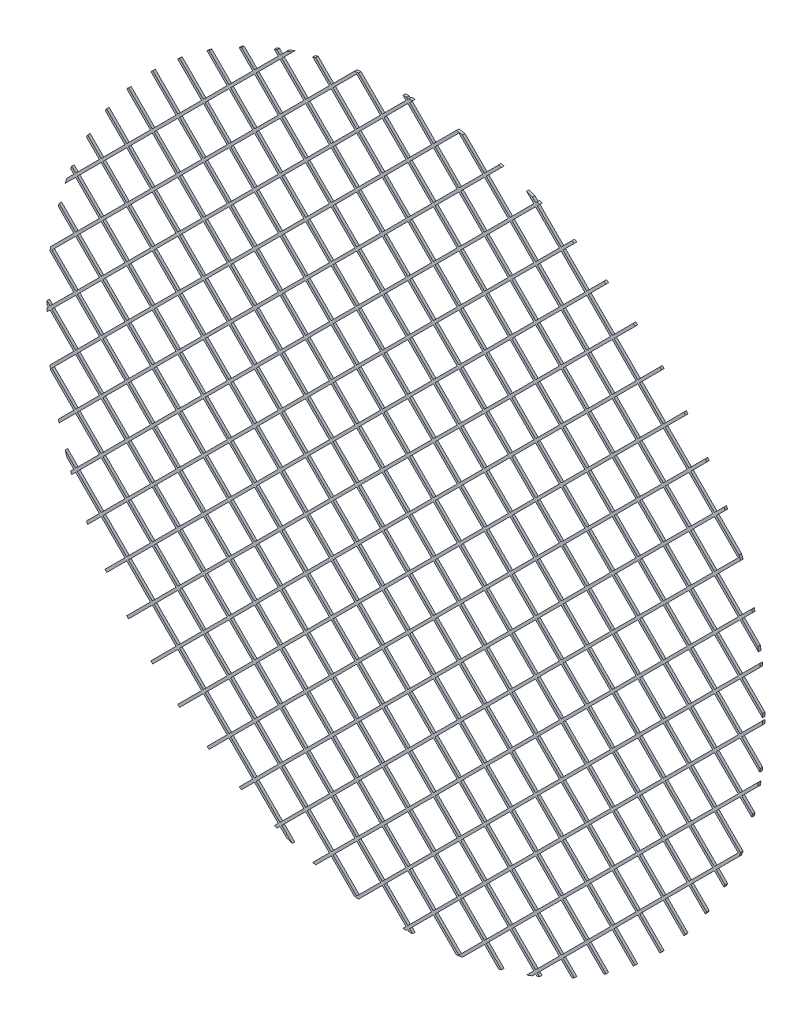
from build123d import *

# Parameters (mm, degrees)
BOSS_EXTRUDE1_DEPTH = 0.05


with BuildPart() as part:
    # Sketch1 → Boss-Extrude1 (new body)
    with BuildSketch(Plane.XY):
        with BuildLine():
            Line((6.560216282, 0.405728477), (6.99991756, -0.033972801))
            ThreePointArc((6.99991756, -0.033972801), (6.999999862, 0.001389576), (6.999903521, 0.036751917))
            Line((6.999903521, 0.036751917), (6.595571621, 0.441083816))
            Line((6.595571621, 0.441083816), (6.954171805, 0.799684))
            ThreePointArc((6.954171805, 0.799684), (6.950466767, 0.831271144), (6.946618255, 0.862841128))
            Line((6.946618255, 0.862841128), (6.560216282, 0.476439155))
            Line((6.560216282, 0.476439155), (6.095571621, 0.941083816))
            Line((6.095571621, 0.941083816), (6.560216282, 1.405728477))
            Line((6.560216282, 1.405728477), (6.921667842, 1.044276917))
            ThreePointArc((6.921667842, 1.044276917), (6.915206502, 1.086240784), (6.90849075, 1.128164688))
            Line((6.90849075, 1.128164688), (6.595571621, 1.441083816))
            Line((6.595571621, 1.441083816), (6.80309457, 1.648606765))
            ThreePointArc((6.80309457, 1.648606765), (6.796156305, 1.676979273), (6.789099711, 1.705322584))
            Line((6.789099711, 1.705322584), (6.560216282, 1.476439155))
            Line((6.560216282, 1.476439155), (6.095571621, 1.941083816))
            Line((6.095571621, 1.941083816), (6.570022305, 2.415534499))
            ThreePointArc((6.570022305, 2.415534499), (6.554836229, 2.456444994), (6.539395413, 2.497260024))
            Line((6.539395413, 2.497260024), (6.095571621, 2.941083816))
            Line((6.095571621, 2.941083816), (6.268970842, 3.114483036))
            ThreePointArc((6.268970842, 3.114483036), (6.257206329, 3.138051777), (6.245353208, 3.16157608))
            Line((6.245353208, 3.16157608), (6.060216282, 2.976439155))
            Line((6.060216282, 2.976439155), (5.595571621, 3.441083816))
            Line((5.595571621, 3.441083816), (5.908345803, 3.753857998))
            ThreePointArc((5.908345803, 3.753857998), (5.894581525, 3.775434895), (5.88073845, 3.796961323))
            Line((5.88073845, 3.796961323), (5.560216282, 3.476439155))
            Line((5.560216282, 3.476439155), (5.095571621, 3.941083816))
            Line((5.095571621, 3.941083816), (5.493216795, 4.33872899))
            ThreePointArc((5.493216795, 4.33872899), (5.477585869, 4.358446173), (5.461884172, 4.378107045))
            Line((5.461884172, 4.378107045), (5.060216282, 3.976439155))
            Line((5.060216282, 3.976439155), (4.595571621, 4.441083816))
            Line((4.595571621, 4.441083816), (5.026388615, 4.871900809))
            ThreePointArc((5.026388615, 4.871900809), (5.008955648, 4.889822422), (4.991458782, 4.907681655))
            Line((4.991458782, 4.907681655), (4.560216282, 4.476439155))
            Line((4.560216282, 4.476439155), (4.095571621, 4.941083816))
            Line((4.095571621, 4.941083816), (4.508904605, 5.3544168))
            ThreePointArc((4.508904605, 5.3544168), (4.489676545, 5.370549741), (4.470390761, 5.386613634))
            Line((4.470390761, 5.386613634), (4.060216282, 4.976439155))
            Line((4.060216282, 4.976439155), (3.595571621, 5.441083816))
            Line((3.595571621, 5.441083816), (3.940218423, 5.785730618))
            ThreePointArc((3.940218423, 5.785730618), (3.919145654, 5.800025633), (3.898021024, 5.814243897))
            Line((3.898021024, 5.814243897), (3.560216282, 5.476439155))
            Line((3.560216282, 5.476439155), (3.095571621, 5.941083816))
            Line((3.095571621, 5.941083816), (3.318105121, 6.163617315))
            ThreePointArc((3.318105121, 6.163617315), (3.295073238, 6.175960845), (3.271995438, 6.18821831))
            Line((3.271995438, 6.18821831), (3.060216282, 5.976439155))
            Line((3.060216282, 5.976439155), (2.595571621, 6.441083816))
            Line((2.595571621, 6.441083816), (2.638275473, 6.483787668))
            ThreePointArc((2.638275473, 6.483787668), (2.61308431, 6.493981089), (2.587853764, 6.504076637))
            Line((2.587853764, 6.504076637), (2.560216282, 6.476439155))
            Line((2.560216282, 6.476439155), (2.497260024, 6.539395413))
            ThreePointArc((2.497260024, 6.539395413), (2.441044694, 6.560586925), (2.384649563, 6.581295197))
            Line((2.384649563, 6.581295197), (2.524860943, 6.441083816))
            Line((2.524860943, 6.441083816), (2.060216282, 5.976439155))
            Line((2.060216282, 5.976439155), (1.595571621, 6.441083816))
            Line((1.595571621, 6.441083816), (1.893521569, 6.739033764))
            ThreePointArc((1.893521569, 6.739033764), (1.865841371, 6.746750031), (1.838129731, 6.754352604))
            Line((1.838129731, 6.754352604), (1.560216282, 6.476439155))
            Line((1.560216282, 6.476439155), (1.128164688, 6.90849075))
            ThreePointArc((1.128164688, 6.90849075), (1.069352141, 6.917838246), (1.010462203, 6.926685076))
            Line((1.010462203, 6.926685076), (0.560216282, 6.476439155))
            Line((0.560216282, 6.476439155), (0.095571621, 6.941083816))
            Line((0.095571621, 6.941083816), (0.152819478, 6.998331673))
            ThreePointArc((0.152819478, 6.998331673), (0.118052042, 6.99900448), (0.083281692, 6.999504565))
            Line((0.083281692, 6.999504565), (0.060216282, 6.976439155))
            Line((0.060216282, 6.976439155), (0.036751917, 6.999903521))
            ThreePointArc((0.036751917, 6.999903521), (0.001389576, 6.999999862), (-0.033972801, 6.99991756))
            Line((-0.033972801, 6.99991756), (0.024860943, 6.941083816))
            Line((0.024860943, 6.941083816), (-0.439783718, 6.476439155))
            Line((-0.439783718, 6.476439155), (-0.904642812, 6.941298249))
            ThreePointArc((-0.904642812, 6.941298249), (-0.945345455, 6.935872113), (-0.986015567, 6.930207306))
            Line((-0.986015567, 6.930207306), (-1.439783718, 6.476439155))
            Line((-1.439783718, 6.476439155), (-1.742895756, 6.779551193))
            ThreePointArc((-1.742895756, 6.779551193), (-1.770937395, 6.772280321), (-1.798948704, 6.764893463))
            Line((-1.798948704, 6.764893463), (-1.475139057, 6.441083816))
            Line((-1.475139057, 6.441083816), (-1.939783718, 5.976439155))
            Line((-1.939783718, 5.976439155), (-2.404428379, 6.441083816))
            Line((-2.404428379, 6.441083816), (-2.200318583, 6.645193611))
            ThreePointArc((-2.200318583, 6.645193611), (-2.253969831, 6.627187941), (-2.307473759, 6.608749114))
            Line((-2.307473759, 6.608749114), (-2.439783718, 6.476439155))
            Line((-2.439783718, 6.476439155), (-2.501224607, 6.537880044))
            ThreePointArc((-2.501224607, 6.537880044), (-2.52673333, 6.52806393), (-2.552203531, 6.51814829))
            Line((-2.552203531, 6.51814829), (-2.475139057, 6.441083816))
            Line((-2.475139057, 6.441083816), (-2.939783718, 5.976439155))
            Line((-2.939783718, 5.976439155), (-3.192795389, 6.229450827))
            ThreePointArc((-3.192795389, 6.229450827), (-3.21611986, 6.217441037), (-3.239399156, 6.205343915))
            Line((-3.239399156, 6.205343915), (-2.975139057, 5.941083816))
            Line((-2.975139057, 5.941083816), (-3.439783718, 5.476439155))
            Line((-3.439783718, 5.476439155), (-3.825535271, 5.862190708))
            ThreePointArc((-3.825535271, 5.862190708), (-3.846887641, 5.848201046), (-3.868188853, 5.834133612))
            Line((-3.868188853, 5.834133612), (-3.475139057, 5.441083816))
            Line((-3.475139057, 5.441083816), (-3.939783718, 4.976439155))
            Line((-3.939783718, 4.976439155), (-4.404205814, 5.440861251))
            ThreePointArc((-4.404205814, 5.440861251), (-4.423709252, 5.425015802), (-4.443155682, 5.409100441))
            Line((-4.443155682, 5.409100441), (-3.975139057, 4.941083816))
            Line((-3.975139057, 4.941083816), (-4.439783718, 4.476439155))
            Line((-4.439783718, 4.476439155), (-4.931385818, 4.968041255))
            ThreePointArc((-4.931385818, 4.968041255), (-4.949097372, 4.950397479), (-4.9667458, 4.932690559))
            Line((-4.9667458, 4.932690559), (-4.475139057, 4.441083816))
            Line((-4.475139057, 4.441083816), (-4.939783718, 3.976439155))
            Line((-4.939783718, 3.976439155), (-5.404428379, 4.441083816))
            Line((-5.404428379, 4.441083816), (-5.438965751, 4.406546444))
            ThreePointArc((-5.438965751, 4.406546444), (-5.439331832, 4.406094555), (-5.439697875, 4.405642635))
            Line((-5.439697875, 4.405642635), (-4.975139057, 3.941083816))
            Line((-4.975139057, 3.941083816), (-5.439783718, 3.476439155))
            Line((-5.439783718, 3.476439155), (-5.833096766, 3.869752203))
            ThreePointArc((-5.833096766, 3.869752203), (-5.847169132, 3.848455942), (-5.861163748, 3.827108507))
            Line((-5.861163748, 3.827108507), (-5.475139057, 3.441083816))
            Line((-5.475139057, 3.441083816), (-5.939783718, 2.976439155))
            Line((-5.939783718, 2.976439155), (-6.204451892, 3.241107329))
            ThreePointArc((-6.204451892, 3.241107329), (-6.216554365, 3.217833406), (-6.228569534, 3.194514293))
            Line((-6.228569534, 3.194514293), (-5.975139057, 2.941083816))
            Line((-5.975139057, 2.941083816), (-6.439783718, 2.476439155))
            Line((-6.439783718, 2.476439155), (-6.517416429, 2.554071866))
            ThreePointArc((-6.517416429, 2.554071866), (-6.527338117, 2.528607741), (-6.537160315, 2.503105074))
            Line((-6.537160315, 2.503105074), (-6.475139057, 2.441083816))
            Line((-6.475139057, 2.441083816), (-6.608749114, 2.307473759))
            ThreePointArc((-6.608749114, 2.307473759), (-6.627187941, 2.253969831), (-6.645193611, 2.200318583))
            Line((-6.645193611, 2.200318583), (-6.439783718, 2.405728477))
            Line((-6.439783718, 2.405728477), (-5.975139057, 1.941083816))
            Line((-5.975139057, 1.941083816), (-6.439783718, 1.476439155))
            Line((-6.439783718, 1.476439155), (-6.764346993, 1.80100243))
            ThreePointArc((-6.764346993, 1.80100243), (-6.771741049, 1.772998356), (-6.779019169, 1.744963928))
            Line((-6.779019169, 1.744963928), (-6.475139057, 1.441083816))
            Line((-6.475139057, 1.441083816), (-6.930207306, 0.986015567))
            ThreePointArc((-6.930207306, 0.986015567), (-6.935715391, 0.946494592), (-6.940998102, 0.906942861))
            Line((-6.940998102, 0.906942861), (-6.475139057, 0.441083816))
            Line((-6.475139057, 0.441083816), (-6.939783718, -0.023560845))
            Line((-6.939783718, -0.023560845), (-6.999904526, 0.036559963))
            ThreePointArc((-6.999904526, 0.036559963), (-6.999999895, 0.001210753), (-6.999916754, -0.034138487))
            Line((-6.999916754, -0.034138487), (-6.975139057, -0.058916184))
            Line((-6.975139057, -0.058916184), (-6.999916754, -0.083693881))
            ThreePointArc((-6.999916754, -0.083693881), (-6.999999895, -0.119043122), (-6.999904526, -0.154392331))
            Line((-6.999904526, -0.154392331), (-6.939783718, -0.094271523))
            Line((-6.939783718, -0.094271523), (-6.475139057, -0.558916184))
            Line((-6.475139057, -0.558916184), (-6.940998102, -1.024775229))
            ThreePointArc((-6.940998102, -1.024775229), (-6.935715391, -1.06432696), (-6.930207306, -1.103847935))
            Line((-6.930207306, -1.103847935), (-6.475139057, -1.558916184))
            Line((-6.475139057, -1.558916184), (-6.779019169, -1.862796296))
            ThreePointArc((-6.779019169, -1.862796296), (-6.771741049, -1.890830725), (-6.764346993, -1.918834799))
            Line((-6.764346993, -1.918834799), (-6.439783718, -1.594271523))
            Line((-6.439783718, -1.594271523), (-5.975139057, -2.058916184))
            Line((-5.975139057, -2.058916184), (-6.439783718, -2.523560845))
            Line((-6.439783718, -2.523560845), (-6.645193611, -2.318150952))
            ThreePointArc((-6.645193611, -2.318150952), (-6.627187941, -2.371802199), (-6.608749114, -2.425306127))
            Line((-6.608749114, -2.425306127), (-6.475139057, -2.558916184))
            Line((-6.475139057, -2.558916184), (-6.537160315, -2.620937442))
            ThreePointArc((-6.537160315, -2.620937442), (-6.527338117, -2.646440109), (-6.517416429, -2.671904234))
            Line((-6.517416429, -2.671904234), (-6.439783718, -2.594271523))
            Line((-6.439783718, -2.594271523), (-5.975139057, -3.058916184))
            Line((-5.975139057, -3.058916184), (-6.228569534, -3.312346661))
            ThreePointArc((-6.228569534, -3.312346661), (-6.216554365, -3.335665774), (-6.204451892, -3.358939697))
            Line((-6.204451892, -3.358939697), (-5.939783718, -3.094271523))
            Line((-5.939783718, -3.094271523), (-5.475139057, -3.558916184))
            Line((-5.475139057, -3.558916184), (-5.861163748, -3.944940875))
            ThreePointArc((-5.861163748, -3.944940875), (-5.847169132, -3.96628831), (-5.833096766, -3.987584572))
            Line((-5.833096766, -3.987584572), (-5.439783718, -3.594271523))
            Line((-5.439783718, -3.594271523), (-4.975139057, -4.058916184))
            Line((-4.975139057, -4.058916184), (-5.439697875, -4.523475003))
            ThreePointArc((-5.439697875, -4.523475003), (-5.439331832, -4.523926923), (-5.438965751, -4.524378812))
            Line((-5.438965751, -4.524378812), (-5.404428379, -4.558916184))
            Line((-5.404428379, -4.558916184), (-4.939783718, -4.094271523))
            Line((-4.939783718, -4.094271523), (-4.475139057, -4.558916184))
            Line((-4.475139057, -4.558916184), (-4.9667458, -5.050522928))
            ThreePointArc((-4.9667458, -5.050522928), (-4.949097372, -5.068229847), (-4.931385818, -5.085873623))
            Line((-4.931385818, -5.085873623), (-4.439783718, -4.594271523))
            Line((-4.439783718, -4.594271523), (-3.975139057, -5.058916184))
            Line((-3.975139057, -5.058916184), (-4.443155682, -5.526932809))
            ThreePointArc((-4.443155682, -5.526932809), (-4.423709252, -5.54284817), (-4.404205814, -5.558693619))
            Line((-4.404205814, -5.558693619), (-3.939783718, -5.094271523))
            Line((-3.939783718, -5.094271523), (-3.475139057, -5.558916184))
            Line((-3.475139057, -5.558916184), (-3.868188853, -5.95196598))
            ThreePointArc((-3.868188853, -5.95196598), (-3.846887641, -5.966033414), (-3.825535271, -5.980023076))
            Line((-3.825535271, -5.980023076), (-3.439783718, -5.594271523))
            Line((-3.439783718, -5.594271523), (-2.975139057, -6.058916184))
            Line((-2.975139057, -6.058916184), (-3.239399156, -6.323176283))
            ThreePointArc((-3.239399156, -6.323176283), (-3.21611986, -6.335273405), (-3.192795389, -6.347283195))
            Line((-3.192795389, -6.347283195), (-2.939783718, -6.094271523))
            Line((-2.939783718, -6.094271523), (-2.475139057, -6.558916184))
            Line((-2.475139057, -6.558916184), (-2.552203531, -6.635980658))
            ThreePointArc((-2.552203531, -6.635980658), (-2.52673333, -6.645896298), (-2.501224607, -6.655712412))
            Line((-2.501224607, -6.655712412), (-2.439783718, -6.594271523))
            Line((-2.439783718, -6.594271523), (-2.307473759, -6.726581482))
            ThreePointArc((-2.307473759, -6.726581482), (-2.253969831, -6.745020309), (-2.200318583, -6.763025979))
            Line((-2.200318583, -6.763025979), (-2.404428379, -6.558916184))
            Line((-2.404428379, -6.558916184), (-1.939783718, -6.094271523))
            Line((-1.939783718, -6.094271523), (-1.475139057, -6.558916184))
            Line((-1.475139057, -6.558916184), (-1.798948704, -6.882725831))
            ThreePointArc((-1.798948704, -6.882725831), (-1.770937395, -6.890112689), (-1.742895756, -6.897383561))
            Line((-1.742895756, -6.897383561), (-1.439783718, -6.594271523))
            Line((-1.439783718, -6.594271523), (-0.986015567, -7.048039674))
            ThreePointArc((-0.986015567, -7.048039674), (-0.945345455, -7.053704481), (-0.904642812, -7.059130617))
            Line((-0.904642812, -7.059130617), (-0.439783718, -6.594271523))
            Line((-0.439783718, -6.594271523), (0.024860943, -7.058916184))
            Line((0.024860943, -7.058916184), (-0.033972801, -7.117749928))
            ThreePointArc((-0.033972801, -7.117749928), (0.001389576, -7.11783223), (0.036751917, -7.117735889))
            Line((0.036751917, -7.117735889), (0.060216282, -7.094271523))
            Line((0.060216282, -7.094271523), (0.083281692, -7.117336933))
            ThreePointArc((0.083281692, -7.117336933), (0.118052042, -7.116836848), (0.152819478, -7.116164041))
            Line((0.152819478, -7.116164041), (0.095571621, -7.058916184))
            Line((0.095571621, -7.058916184), (0.560216282, -6.594271523))
            Line((0.560216282, -6.594271523), (1.010462203, -7.044517444))
            ThreePointArc((1.010462203, -7.044517444), (1.069352141, -7.035670614), (1.128164688, -7.026323118))
            Line((1.128164688, -7.026323118), (1.560216282, -6.594271523))
            Line((1.560216282, -6.594271523), (1.838129731, -6.872184972))
            ThreePointArc((1.838129731, -6.872184972), (1.865841371, -6.864582399), (1.893521569, -6.856866132))
            Line((1.893521569, -6.856866132), (1.595571621, -6.558916184))
            Line((1.595571621, -6.558916184), (2.060216282, -6.094271523))
            Line((2.060216282, -6.094271523), (2.524860943, -6.558916184))
            Line((2.524860943, -6.558916184), (2.384649563, -6.699127565))
            ThreePointArc((2.384649563, -6.699127565), (2.441044694, -6.678419293), (2.497260024, -6.657227782))
            Line((2.497260024, -6.657227782), (2.560216282, -6.594271523))
            Line((2.560216282, -6.594271523), (2.587853764, -6.621909005))
            ThreePointArc((2.587853764, -6.621909005), (2.61308431, -6.611813457), (2.638275473, -6.601620036))
            Line((2.638275473, -6.601620036), (2.595571621, -6.558916184))
            Line((2.595571621, -6.558916184), (3.060216282, -6.094271523))
            Line((3.060216282, -6.094271523), (3.271995438, -6.306050678))
            ThreePointArc((3.271995438, -6.306050678), (3.295073238, -6.293793213), (3.318105121, -6.281449683))
            Line((3.318105121, -6.281449683), (3.095571621, -6.058916184))
            Line((3.095571621, -6.058916184), (3.560216282, -5.594271523))
            Line((3.560216282, -5.594271523), (3.898021024, -5.932076265))
            ThreePointArc((3.898021024, -5.932076265), (3.919145654, -5.917858001), (3.940218423, -5.903562986))
            Line((3.940218423, -5.903562986), (3.595571621, -5.558916184))
            Line((3.595571621, -5.558916184), (4.060216282, -5.094271523))
            Line((4.060216282, -5.094271523), (4.470390761, -5.504446002))
            ThreePointArc((4.470390761, -5.504446002), (4.489676545, -5.488382109), (4.508904605, -5.472249168))
            Line((4.508904605, -5.472249168), (4.095571621, -5.058916184))
            Line((4.095571621, -5.058916184), (4.560216282, -4.594271523))
            Line((4.560216282, -4.594271523), (4.991458782, -5.025514023))
            ThreePointArc((4.991458782, -5.025514023), (5.008955648, -5.00765479), (5.026388615, -4.989733177))
            Line((5.026388615, -4.989733177), (4.595571621, -4.558916184))
            Line((4.595571621, -4.558916184), (5.060216282, -4.094271523))
            Line((5.060216282, -4.094271523), (5.461884172, -4.495939413))
            ThreePointArc((5.461884172, -4.495939413), (5.477585869, -4.476278541), (5.493216795, -4.456561358))
            Line((5.493216795, -4.456561358), (5.095571621, -4.058916184))
            Line((5.095571621, -4.058916184), (5.560216282, -3.594271523))
            Line((5.560216282, -3.594271523), (5.88073845, -3.914793691))
            ThreePointArc((5.88073845, -3.914793691), (5.894581525, -3.893267263), (5.908345803, -3.871690366))
            Line((5.908345803, -3.871690366), (5.595571621, -3.558916184))
            Line((5.595571621, -3.558916184), (6.060216282, -3.094271523))
            Line((6.060216282, -3.094271523), (6.245353208, -3.279408449))
            ThreePointArc((6.245353208, -3.279408449), (6.257206329, -3.255884146), (6.268970842, -3.232315405))
            Line((6.268970842, -3.232315405), (6.095571621, -3.058916184))
            Line((6.095571621, -3.058916184), (6.539395413, -2.615092392))
            ThreePointArc((6.539395413, -2.615092392), (6.554836229, -2.574277362), (6.570022305, -2.533366867))
            Line((6.570022305, -2.533366867), (6.095571621, -2.058916184))
            Line((6.095571621, -2.058916184), (6.560216282, -1.594271523))
            Line((6.560216282, -1.594271523), (6.789099711, -1.823154952))
            ThreePointArc((6.789099711, -1.823154952), (6.796156305, -1.794811641), (6.80309457, -1.766439133))
            Line((6.80309457, -1.766439133), (6.595571621, -1.558916184))
            Line((6.595571621, -1.558916184), (6.90849075, -1.245997056))
            ThreePointArc((6.90849075, -1.245997056), (6.915206502, -1.204073152), (6.921667842, -1.162109285))
            Line((6.921667842, -1.162109285), (6.560216282, -1.523560845))
            Line((6.560216282, -1.523560845), (6.095571621, -1.058916184))
            Line((6.095571621, -1.058916184), (6.560216282, -0.594271523))
            Line((6.560216282, -0.594271523), (6.946618255, -0.980673496))
            ThreePointArc((6.946618255, -0.980673496), (6.950466767, -0.949103512), (6.954171805, -0.917516368))
            Line((6.954171805, -0.917516368), (6.595571621, -0.558916184))
            Line((6.595571621, -0.558916184), (6.999903521, -0.154584285))
            ThreePointArc((6.999903521, -0.154584285), (6.999999862, -0.119221944), (6.99991756, -0.083859567))
            Line((6.99991756, -0.083859567), (6.560216282, -0.523560845))
            Line((6.560216282, -0.523560845), (6.095571621, -0.058916184))
            Line((6.095571621, -0.058916184), (6.560216282, 0.405728477))
        make_face()
        Polygon((5.560216282, 0.405728477), (6.024860943, -0.058916184), (5.560216282, -0.523560845), (5.095571621, -0.058916184), align=None, mode=Mode.SUBTRACT)
        Polygon((4.560216282, 0.405728477), (5.024860943, -0.058916184), (4.560216282, -0.523560845), (4.095571621, -0.058916184), align=None, mode=Mode.SUBTRACT)
        Polygon((3.560216282, 0.405728477), (4.024860943, -0.058916184), (3.560216282, -0.523560845), (3.095571621, -0.058916184), align=None, mode=Mode.SUBTRACT)
        Polygon((2.560216282, 0.405728477), (3.024860943, -0.058916184), (2.560216282, -0.523560845), (2.095571621, -0.058916184), align=None, mode=Mode.SUBTRACT)
        Polygon((1.560216282, 0.405728477), (2.024860943, -0.058916184), (1.560216282, -0.523560845), (1.095571621, -0.058916184), align=None, mode=Mode.SUBTRACT)
        Polygon((0.560216282, 0.405728477), (1.024860943, -0.058916184), (0.560216282, -0.523560845), (0.095571621, -0.058916184), align=None, mode=Mode.SUBTRACT)
        Polygon((-0.439783718, 0.405728477), (0.024860943, -0.058916184), (-0.439783718, -0.523560845), (-0.904428379, -0.058916184), align=None, mode=Mode.SUBTRACT)
        Polygon((-1.439783718, 0.405728477), (-0.975139057, -0.058916184), (-1.439783718, -0.523560845), (-1.904428379, -0.058916184), align=None, mode=Mode.SUBTRACT)
        Polygon((-2.439783718, 0.405728477), (-1.975139057, -0.058916184), (-2.439783718, -0.523560845), (-2.904428379, -0.058916184), align=None, mode=Mode.SUBTRACT)
        Polygon((-3.439783718, 0.405728477), (-2.975139057, -0.058916184), (-3.439783718, -0.523560845), (-3.904428379, -0.058916184), align=None, mode=Mode.SUBTRACT)
        Polygon((-4.439783718, 0.405728477), (-3.975139057, -0.058916184), (-4.439783718, -0.523560845), (-4.904428379, -0.058916184), align=None, mode=Mode.SUBTRACT)
        Polygon((-5.439783718, 0.405728477), (-4.975139057, -0.058916184), (-5.439783718, -0.523560845), (-5.904428379, -0.058916184), align=None, mode=Mode.SUBTRACT)
        Polygon((-6.439783718, 0.405728477), (-5.975139057, -0.058916184), (-6.439783718, -0.523560845), (-6.904428379, -0.058916184), align=None, mode=Mode.SUBTRACT)
        Polygon((-5.939783718, 0.905728477), (-5.475139057, 0.441083816), (-5.939783718, -0.023560845), (-6.404428379, 0.441083816), align=None, mode=Mode.SUBTRACT)
        Polygon((-6.439783718, 0.476439155), (-6.904428379, 0.941083816), (-6.439783718, 1.405728477), (-5.975139057, 0.941083816), align=None, mode=Mode.SUBTRACT)
        Polygon((-5.439783718, 0.476439155), (-5.904428379, 0.941083816), (-5.439783718, 1.405728477), (-4.975139057, 0.941083816), align=None, mode=Mode.SUBTRACT)
        Polygon((-5.939783718, 1.905728477), (-5.475139057, 1.441083816), (-5.939783718, 0.976439155), (-6.404428379, 1.441083816), align=None, mode=Mode.SUBTRACT)
        Polygon((-4.939783718, 0.905728477), (-4.475139057, 0.441083816), (-4.939783718, -0.023560845), (-5.404428379, 0.441083816), align=None, mode=Mode.SUBTRACT)
        Polygon((-3.939783718, 0.905728477), (-3.475139057, 0.441083816), (-3.939783718, -0.023560845), (-4.404428379, 0.441083816), align=None, mode=Mode.SUBTRACT)
        Polygon((-4.439783718, 0.476439155), (-4.904428379, 0.941083816), (-4.439783718, 1.405728477), (-3.975139057, 0.941083816), align=None, mode=Mode.SUBTRACT)
        Polygon((-4.939783718, 1.905728477), (-4.475139057, 1.441083816), (-4.939783718, 0.976439155), (-5.404428379, 1.441083816), align=None, mode=Mode.SUBTRACT)
        Polygon((-3.939783718, 1.905728477), (-3.475139057, 1.441083816), (-3.939783718, 0.976439155), (-4.404428379, 1.441083816), align=None, mode=Mode.SUBTRACT)
        Polygon((-5.439783718, 1.476439155), (-5.904428379, 1.941083816), (-5.439783718, 2.405728477), (-4.975139057, 1.941083816), align=None, mode=Mode.SUBTRACT)
        Polygon((-5.939783718, 2.905728477), (-5.475139057, 2.441083816), (-5.939783718, 1.976439155), (-6.404428379, 2.441083816), align=None, mode=Mode.SUBTRACT)
        Polygon((-5.439783718, 2.476439155), (-5.904428379, 2.941083816), (-5.439783718, 3.405728477), (-4.975139057, 2.941083816), align=None, mode=Mode.SUBTRACT)
        Polygon((-4.439783718, 1.476439155), (-4.904428379, 1.941083816), (-4.439783718, 2.405728477), (-3.975139057, 1.941083816), align=None, mode=Mode.SUBTRACT)
        Polygon((-4.939783718, 2.905728477), (-4.475139057, 2.441083816), (-4.939783718, 1.976439155), (-5.404428379, 2.441083816), align=None, mode=Mode.SUBTRACT)
        Polygon((-3.939783718, 2.905728477), (-3.475139057, 2.441083816), (-3.939783718, 1.976439155), (-4.404428379, 2.441083816), align=None, mode=Mode.SUBTRACT)
        Polygon((-4.439783718, 2.476439155), (-4.904428379, 2.941083816), (-4.439783718, 3.405728477), (-3.975139057, 2.941083816), align=None, mode=Mode.SUBTRACT)
        Polygon((-4.939783718, 3.905728477), (-4.475139057, 3.441083816), (-4.939783718, 2.976439155), (-5.404428379, 3.441083816), align=None, mode=Mode.SUBTRACT)
        Polygon((-3.939783718, 3.905728477), (-3.475139057, 3.441083816), (-3.939783718, 2.976439155), (-4.404428379, 3.441083816), align=None, mode=Mode.SUBTRACT)
        Polygon((-2.939783718, 0.905728477), (-2.475139057, 0.441083816), (-2.939783718, -0.023560845), (-3.404428379, 0.441083816), align=None, mode=Mode.SUBTRACT)
        Polygon((-1.939783718, 0.905728477), (-1.475139057, 0.441083816), (-1.939783718, -0.023560845), (-2.404428379, 0.441083816), align=None, mode=Mode.SUBTRACT)
        Polygon((-3.439783718, 0.476439155), (-3.904428379, 0.941083816), (-3.439783718, 1.405728477), (-2.975139057, 0.941083816), align=None, mode=Mode.SUBTRACT)
        Polygon((-2.939783718, 1.905728477), (-2.475139057, 1.441083816), (-2.939783718, 0.976439155), (-3.404428379, 1.441083816), align=None, mode=Mode.SUBTRACT)
        Polygon((-2.439783718, 0.476439155), (-2.904428379, 0.941083816), (-2.439783718, 1.405728477), (-1.975139057, 0.941083816), align=None, mode=Mode.SUBTRACT)
        Polygon((-1.939783718, 1.905728477), (-1.475139057, 1.441083816), (-1.939783718, 0.976439155), (-2.404428379, 1.441083816), align=None, mode=Mode.SUBTRACT)
        Polygon((-0.939783718, 0.905728477), (-0.475139057, 0.441083816), (-0.939783718, -0.023560845), (-1.404428379, 0.441083816), align=None, mode=Mode.SUBTRACT)
        Polygon((-1.439783718, 0.476439155), (-1.904428379, 0.941083816), (-1.439783718, 1.405728477), (-0.975139057, 0.941083816), align=None, mode=Mode.SUBTRACT)
        Polygon((-0.939783718, 1.905728477), (-0.475139057, 1.441083816), (-0.939783718, 0.976439155), (-1.404428379, 1.441083816), align=None, mode=Mode.SUBTRACT)
        Polygon((-0.439783718, 0.476439155), (-0.904428379, 0.941083816), (-0.439783718, 1.405728477), (0.024860943, 0.941083816), align=None, mode=Mode.SUBTRACT)
        Polygon((-3.439783718, 1.476439155), (-3.904428379, 1.941083816), (-3.439783718, 2.405728477), (-2.975139057, 1.941083816), align=None, mode=Mode.SUBTRACT)
        Polygon((-2.939783718, 2.905728477), (-2.475139057, 2.441083816), (-2.939783718, 1.976439155), (-3.404428379, 2.441083816), align=None, mode=Mode.SUBTRACT)
        Polygon((-2.439783718, 1.476439155), (-2.904428379, 1.941083816), (-2.439783718, 2.405728477), (-1.975139057, 1.941083816), align=None, mode=Mode.SUBTRACT)
        Polygon((-1.939783718, 2.905728477), (-1.475139057, 2.441083816), (-1.939783718, 1.976439155), (-2.404428379, 2.441083816), align=None, mode=Mode.SUBTRACT)
        Polygon((-3.439783718, 2.476439155), (-3.904428379, 2.941083816), (-3.439783718, 3.405728477), (-2.975139057, 2.941083816), align=None, mode=Mode.SUBTRACT)
        Polygon((-2.939783718, 3.905728477), (-2.475139057, 3.441083816), (-2.939783718, 2.976439155), (-3.404428379, 3.441083816), align=None, mode=Mode.SUBTRACT)
        Polygon((-2.439783718, 2.476439155), (-2.904428379, 2.941083816), (-2.439783718, 3.405728477), (-1.975139057, 2.941083816), align=None, mode=Mode.SUBTRACT)
        Polygon((-1.939783718, 3.905728477), (-1.475139057, 3.441083816), (-1.939783718, 2.976439155), (-2.404428379, 3.441083816), align=None, mode=Mode.SUBTRACT)
        Polygon((-1.439783718, 1.476439155), (-1.904428379, 1.941083816), (-1.439783718, 2.405728477), (-0.975139057, 1.941083816), align=None, mode=Mode.SUBTRACT)
        Polygon((-0.939783718, 2.905728477), (-0.475139057, 2.441083816), (-0.939783718, 1.976439155), (-1.404428379, 2.441083816), align=None, mode=Mode.SUBTRACT)
        Polygon((-0.439783718, 1.476439155), (-0.904428379, 1.941083816), (-0.439783718, 2.405728477), (0.024860943, 1.941083816), align=None, mode=Mode.SUBTRACT)
        Polygon((-1.439783718, 2.476439155), (-1.904428379, 2.941083816), (-1.439783718, 3.405728477), (-0.975139057, 2.941083816), align=None, mode=Mode.SUBTRACT)
        Polygon((-0.939783718, 3.905728477), (-0.475139057, 3.441083816), (-0.939783718, 2.976439155), (-1.404428379, 3.441083816), align=None, mode=Mode.SUBTRACT)
        Polygon((-0.439783718, 2.476439155), (-0.904428379, 2.941083816), (-0.439783718, 3.405728477), (0.024860943, 2.941083816), align=None, mode=Mode.SUBTRACT)
        Polygon((-4.439783718, 3.476439155), (-4.904428379, 3.941083816), (-4.439783718, 4.405728477), (-3.975139057, 3.941083816), align=None, mode=Mode.SUBTRACT)
        Polygon((-3.939783718, 3.976439155), (-4.404428379, 4.441083816), (-3.939783718, 4.905728477), (-3.475139057, 4.441083816), align=None, mode=Mode.SUBTRACT)
        Polygon((-3.439783718, 3.476439155), (-3.904428379, 3.941083816), (-3.439783718, 4.405728477), (-2.975139057, 3.941083816), align=None, mode=Mode.SUBTRACT)
        Polygon((-2.439783718, 3.476439155), (-2.904428379, 3.941083816), (-2.439783718, 4.405728477), (-1.975139057, 3.941083816), align=None, mode=Mode.SUBTRACT)
        Polygon((-2.939783718, 3.976439155), (-3.404428379, 4.441083816), (-2.939783718, 4.905728477), (-2.475139057, 4.441083816), align=None, mode=Mode.SUBTRACT)
        Polygon((-3.439783718, 5.405728477), (-2.975139057, 4.941083816), (-3.439783718, 4.476439155), (-3.904428379, 4.941083816), align=None, mode=Mode.SUBTRACT)
        Polygon((-1.939783718, 3.976439155), (-2.404428379, 4.441083816), (-1.939783718, 4.905728477), (-1.475139057, 4.441083816), align=None, mode=Mode.SUBTRACT)
        Polygon((-2.439783718, 5.405728477), (-1.975139057, 4.941083816), (-2.439783718, 4.476439155), (-2.904428379, 4.941083816), align=None, mode=Mode.SUBTRACT)
        Polygon((-1.439783718, 3.476439155), (-1.904428379, 3.941083816), (-1.439783718, 4.405728477), (-0.975139057, 3.941083816), align=None, mode=Mode.SUBTRACT)
        Polygon((-0.439783718, 3.476439155), (-0.904428379, 3.941083816), (-0.439783718, 4.405728477), (0.024860943, 3.941083816), align=None, mode=Mode.SUBTRACT)
        Polygon((-0.939783718, 3.976439155), (-1.404428379, 4.441083816), (-0.939783718, 4.905728477), (-0.475139057, 4.441083816), align=None, mode=Mode.SUBTRACT)
        Polygon((-1.439783718, 5.405728477), (-0.975139057, 4.941083816), (-1.439783718, 4.476439155), (-1.904428379, 4.941083816), align=None, mode=Mode.SUBTRACT)
        Polygon((-0.439783718, 5.405728477), (0.024860943, 4.941083816), (-0.439783718, 4.476439155), (-0.904428379, 4.941083816), align=None, mode=Mode.SUBTRACT)
        Polygon((-2.939783718, 4.976439155), (-3.404428379, 5.441083816), (-2.939783718, 5.905728477), (-2.475139057, 5.441083816), align=None, mode=Mode.SUBTRACT)
        Polygon((-1.939783718, 4.976439155), (-2.404428379, 5.441083816), (-1.939783718, 5.905728477), (-1.475139057, 5.441083816), align=None, mode=Mode.SUBTRACT)
        Polygon((-2.439783718, 5.476439155), (-2.904428379, 5.941083816), (-2.439783718, 6.405728477), (-1.975139057, 5.941083816), align=None, mode=Mode.SUBTRACT)
        Polygon((-0.939783718, 4.976439155), (-1.404428379, 5.441083816), (-0.939783718, 5.905728477), (-0.475139057, 5.441083816), align=None, mode=Mode.SUBTRACT)
        Polygon((-1.439783718, 5.476439155), (-1.904428379, 5.941083816), (-1.439783718, 6.405728477), (-0.975139057, 5.941083816), align=None, mode=Mode.SUBTRACT)
        Polygon((-0.439783718, 5.476439155), (-0.904428379, 5.941083816), (-0.439783718, 6.405728477), (0.024860943, 5.941083816), align=None, mode=Mode.SUBTRACT)
        Polygon((-0.939783718, 5.976439155), (-1.404428379, 6.441083816), (-0.939783718, 6.905728477), (-0.475139057, 6.441083816), align=None, mode=Mode.SUBTRACT)
        Polygon((0.060216282, 0.905728477), (0.524860943, 0.441083816), (0.060216282, -0.023560845), (-0.404428379, 0.441083816), align=None, mode=Mode.SUBTRACT)
        Polygon((1.060216282, 0.905728477), (1.524860943, 0.441083816), (1.060216282, -0.023560845), (0.595571621, 0.441083816), align=None, mode=Mode.SUBTRACT)
        Polygon((0.560216282, 0.476439155), (0.095571621, 0.941083816), (0.560216282, 1.405728477), (1.024860943, 0.941083816), align=None, mode=Mode.SUBTRACT)
        Polygon((0.060216282, 1.905728477), (0.524860943, 1.441083816), (0.060216282, 0.976439155), (-0.404428379, 1.441083816), align=None, mode=Mode.SUBTRACT)
        Polygon((1.560216282, 0.476439155), (1.095571621, 0.941083816), (1.560216282, 1.405728477), (2.024860943, 0.941083816), align=None, mode=Mode.SUBTRACT)
        Polygon((1.060216282, 1.905728477), (1.524860943, 1.441083816), (1.060216282, 0.976439155), (0.595571621, 1.441083816), align=None, mode=Mode.SUBTRACT)
        Polygon((2.060216282, 0.905728477), (2.524860943, 0.441083816), (2.060216282, -0.023560845), (1.595571621, 0.441083816), align=None, mode=Mode.SUBTRACT)
        Polygon((3.060216282, 0.905728477), (3.524860943, 0.441083816), (3.060216282, -0.023560845), (2.595571621, 0.441083816), align=None, mode=Mode.SUBTRACT)
        Polygon((2.560216282, 0.476439155), (2.095571621, 0.941083816), (2.560216282, 1.405728477), (3.024860943, 0.941083816), align=None, mode=Mode.SUBTRACT)
        Polygon((2.060216282, 1.905728477), (2.524860943, 1.441083816), (2.060216282, 0.976439155), (1.595571621, 1.441083816), align=None, mode=Mode.SUBTRACT)
        Polygon((3.060216282, 1.905728477), (3.524860943, 1.441083816), (3.060216282, 0.976439155), (2.595571621, 1.441083816), align=None, mode=Mode.SUBTRACT)
        Polygon((0.560216282, 1.476439155), (0.095571621, 1.941083816), (0.560216282, 2.405728477), (1.024860943, 1.941083816), align=None, mode=Mode.SUBTRACT)
        Polygon((0.060216282, 2.905728477), (0.524860943, 2.441083816), (0.060216282, 1.976439155), (-0.404428379, 2.441083816), align=None, mode=Mode.SUBTRACT)
        Polygon((1.560216282, 1.476439155), (1.095571621, 1.941083816), (1.560216282, 2.405728477), (2.024860943, 1.941083816), align=None, mode=Mode.SUBTRACT)
        Polygon((1.060216282, 2.905728477), (1.524860943, 2.441083816), (1.060216282, 1.976439155), (0.595571621, 2.441083816), align=None, mode=Mode.SUBTRACT)
        Polygon((0.560216282, 2.476439155), (0.095571621, 2.941083816), (0.560216282, 3.405728477), (1.024860943, 2.941083816), align=None, mode=Mode.SUBTRACT)
        Polygon((0.060216282, 3.905728477), (0.524860943, 3.441083816), (0.060216282, 2.976439155), (-0.404428379, 3.441083816), align=None, mode=Mode.SUBTRACT)
        Polygon((1.560216282, 2.476439155), (1.095571621, 2.941083816), (1.560216282, 3.405728477), (2.024860943, 2.941083816), align=None, mode=Mode.SUBTRACT)
        Polygon((1.060216282, 3.905728477), (1.524860943, 3.441083816), (1.060216282, 2.976439155), (0.595571621, 3.441083816), align=None, mode=Mode.SUBTRACT)
        Polygon((2.560216282, 1.476439155), (2.095571621, 1.941083816), (2.560216282, 2.405728477), (3.024860943, 1.941083816), align=None, mode=Mode.SUBTRACT)
        Polygon((2.060216282, 2.905728477), (2.524860943, 2.441083816), (2.060216282, 1.976439155), (1.595571621, 2.441083816), align=None, mode=Mode.SUBTRACT)
        Polygon((3.060216282, 2.905728477), (3.524860943, 2.441083816), (3.060216282, 1.976439155), (2.595571621, 2.441083816), align=None, mode=Mode.SUBTRACT)
        Polygon((2.560216282, 2.476439155), (2.095571621, 2.941083816), (2.560216282, 3.405728477), (3.024860943, 2.941083816), align=None, mode=Mode.SUBTRACT)
        Polygon((2.060216282, 3.905728477), (2.524860943, 3.441083816), (2.060216282, 2.976439155), (1.595571621, 3.441083816), align=None, mode=Mode.SUBTRACT)
        Polygon((3.060216282, 3.905728477), (3.524860943, 3.441083816), (3.060216282, 2.976439155), (2.595571621, 3.441083816), align=None, mode=Mode.SUBTRACT)
        Polygon((4.060216282, 0.905728477), (4.524860943, 0.441083816), (4.060216282, -0.023560845), (3.595571621, 0.441083816), align=None, mode=Mode.SUBTRACT)
        Polygon((5.060216282, 0.905728477), (5.524860943, 0.441083816), (5.060216282, -0.023560845), (4.595571621, 0.441083816), align=None, mode=Mode.SUBTRACT)
        Polygon((3.560216282, 0.476439155), (3.095571621, 0.941083816), (3.560216282, 1.405728477), (4.024860943, 0.941083816), align=None, mode=Mode.SUBTRACT)
        Polygon((4.060216282, 1.905728477), (4.524860943, 1.441083816), (4.060216282, 0.976439155), (3.595571621, 1.441083816), align=None, mode=Mode.SUBTRACT)
        Polygon((4.560216282, 0.476439155), (4.095571621, 0.941083816), (4.560216282, 1.405728477), (5.024860943, 0.941083816), align=None, mode=Mode.SUBTRACT)
        Polygon((5.060216282, 1.905728477), (5.524860943, 1.441083816), (5.060216282, 0.976439155), (4.595571621, 1.441083816), align=None, mode=Mode.SUBTRACT)
        Polygon((6.060216282, 0.905728477), (6.524860943, 0.441083816), (6.060216282, -0.023560845), (5.595571621, 0.441083816), align=None, mode=Mode.SUBTRACT)
        Polygon((5.560216282, 0.476439155), (5.095571621, 0.941083816), (5.560216282, 1.405728477), (6.024860943, 0.941083816), align=None, mode=Mode.SUBTRACT)
        Polygon((6.060216282, 1.905728477), (6.524860943, 1.441083816), (6.060216282, 0.976439155), (5.595571621, 1.441083816), align=None, mode=Mode.SUBTRACT)
        Polygon((3.560216282, 1.476439155), (3.095571621, 1.941083816), (3.560216282, 2.405728477), (4.024860943, 1.941083816), align=None, mode=Mode.SUBTRACT)
        Polygon((4.060216282, 2.905728477), (4.524860943, 2.441083816), (4.060216282, 1.976439155), (3.595571621, 2.441083816), align=None, mode=Mode.SUBTRACT)
        Polygon((4.560216282, 1.476439155), (4.095571621, 1.941083816), (4.560216282, 2.405728477), (5.024860943, 1.941083816), align=None, mode=Mode.SUBTRACT)
        Polygon((5.060216282, 2.905728477), (5.524860943, 2.441083816), (5.060216282, 1.976439155), (4.595571621, 2.441083816), align=None, mode=Mode.SUBTRACT)
        Polygon((3.560216282, 2.476439155), (3.095571621, 2.941083816), (3.560216282, 3.405728477), (4.024860943, 2.941083816), align=None, mode=Mode.SUBTRACT)
        Polygon((4.060216282, 3.905728477), (4.524860943, 3.441083816), (4.060216282, 2.976439155), (3.595571621, 3.441083816), align=None, mode=Mode.SUBTRACT)
        Polygon((4.560216282, 2.476439155), (4.095571621, 2.941083816), (4.560216282, 3.405728477), (5.024860943, 2.941083816), align=None, mode=Mode.SUBTRACT)
        Polygon((5.060216282, 3.905728477), (5.524860943, 3.441083816), (5.060216282, 2.976439155), (4.595571621, 3.441083816), align=None, mode=Mode.SUBTRACT)
        Polygon((5.560216282, 1.476439155), (5.095571621, 1.941083816), (5.560216282, 2.405728477), (6.024860943, 1.941083816), align=None, mode=Mode.SUBTRACT)
        Polygon((6.060216282, 2.905728477), (6.524860943, 2.441083816), (6.060216282, 1.976439155), (5.595571621, 2.441083816), align=None, mode=Mode.SUBTRACT)
        Polygon((5.560216282, 2.476439155), (5.095571621, 2.941083816), (5.560216282, 3.405728477), (6.024860943, 2.941083816), align=None, mode=Mode.SUBTRACT)
        Polygon((0.560216282, 3.476439155), (0.095571621, 3.941083816), (0.560216282, 4.405728477), (1.024860943, 3.941083816), align=None, mode=Mode.SUBTRACT)
        Polygon((1.560216282, 3.476439155), (1.095571621, 3.941083816), (1.560216282, 4.405728477), (2.024860943, 3.941083816), align=None, mode=Mode.SUBTRACT)
        Polygon((0.060216282, 3.976439155), (-0.404428379, 4.441083816), (0.060216282, 4.905728477), (0.524860943, 4.441083816), align=None, mode=Mode.SUBTRACT)
        Polygon((0.560216282, 5.405728477), (1.024860943, 4.941083816), (0.560216282, 4.476439155), (0.095571621, 4.941083816), align=None, mode=Mode.SUBTRACT)
        Polygon((1.060216282, 3.976439155), (0.595571621, 4.441083816), (1.060216282, 4.905728477), (1.524860943, 4.441083816), align=None, mode=Mode.SUBTRACT)
        Polygon((1.560216282, 5.405728477), (2.024860943, 4.941083816), (1.560216282, 4.476439155), (1.095571621, 4.941083816), align=None, mode=Mode.SUBTRACT)
        Polygon((2.560216282, 3.476439155), (2.095571621, 3.941083816), (2.560216282, 4.405728477), (3.024860943, 3.941083816), align=None, mode=Mode.SUBTRACT)
        Polygon((2.060216282, 3.976439155), (1.595571621, 4.441083816), (2.060216282, 4.905728477), (2.524860943, 4.441083816), align=None, mode=Mode.SUBTRACT)
        Polygon((2.560216282, 5.405728477), (3.024860943, 4.941083816), (2.560216282, 4.476439155), (2.095571621, 4.941083816), align=None, mode=Mode.SUBTRACT)
        Polygon((3.060216282, 3.976439155), (2.595571621, 4.441083816), (3.060216282, 4.905728477), (3.524860943, 4.441083816), align=None, mode=Mode.SUBTRACT)
        Polygon((0.060216282, 4.976439155), (-0.404428379, 5.441083816), (0.060216282, 5.905728477), (0.524860943, 5.441083816), align=None, mode=Mode.SUBTRACT)
        Polygon((0.560216282, 5.476439155), (0.095571621, 5.941083816), (0.560216282, 6.405728477), (1.024860943, 5.941083816), align=None, mode=Mode.SUBTRACT)
        Polygon((1.060216282, 4.976439155), (0.595571621, 5.441083816), (1.060216282, 5.905728477), (1.524860943, 5.441083816), align=None, mode=Mode.SUBTRACT)
        Polygon((1.560216282, 5.476439155), (1.095571621, 5.941083816), (1.560216282, 6.405728477), (2.024860943, 5.941083816), align=None, mode=Mode.SUBTRACT)
        Polygon((0.060216282, 5.976439155), (-0.404428379, 6.441083816), (0.060216282, 6.905728477), (0.524860943, 6.441083816), align=None, mode=Mode.SUBTRACT)
        Polygon((1.060216282, 6.905728477), (1.524860943, 6.441083816), (1.060216282, 5.976439155), (0.595571621, 6.441083816), align=None, mode=Mode.SUBTRACT)
        Polygon((2.060216282, 4.976439155), (1.595571621, 5.441083816), (2.060216282, 5.905728477), (2.524860943, 5.441083816), align=None, mode=Mode.SUBTRACT)
        Polygon((2.560216282, 5.476439155), (2.095571621, 5.941083816), (2.560216282, 6.405728477), (3.024860943, 5.941083816), align=None, mode=Mode.SUBTRACT)
        Polygon((3.060216282, 4.976439155), (2.595571621, 5.441083816), (3.060216282, 5.905728477), (3.524860943, 5.441083816), align=None, mode=Mode.SUBTRACT)
        Polygon((3.560216282, 3.476439155), (3.095571621, 3.941083816), (3.560216282, 4.405728477), (4.024860943, 3.941083816), align=None, mode=Mode.SUBTRACT)
        Polygon((4.560216282, 3.476439155), (4.095571621, 3.941083816), (4.560216282, 4.405728477), (5.024860943, 3.941083816), align=None, mode=Mode.SUBTRACT)
        Polygon((4.060216282, 3.976439155), (3.595571621, 4.441083816), (4.060216282, 4.905728477), (4.524860943, 4.441083816), align=None, mode=Mode.SUBTRACT)
        Polygon((3.560216282, 5.405728477), (4.024860943, 4.941083816), (3.560216282, 4.476439155), (3.095571621, 4.941083816), align=None, mode=Mode.SUBTRACT)
        Polygon((5.524860943, -0.558916184), (5.060216282, -1.023560845), (4.595571621, -0.558916184), (5.060216282, -0.094271523), align=None, mode=Mode.SUBTRACT)
        Polygon((5.595571621, -1.558916184), (6.060216282, -1.094271523), (6.524860943, -1.558916184), (6.060216282, -2.023560845), align=None, mode=Mode.SUBTRACT)
        Polygon((5.095571621, -1.058916184), (5.560216282, -0.594271523), (6.024860943, -1.058916184), (5.560216282, -1.523560845), align=None, mode=Mode.SUBTRACT)
        Polygon((5.595571621, -0.558916184), (6.060216282, -0.094271523), (6.524860943, -0.558916184), (6.060216282, -1.023560845), align=None, mode=Mode.SUBTRACT)
        Polygon((-4.404428379, -4.558916184), (-3.939783718, -4.094271523), (-3.475139057, -4.558916184), (-3.939783718, -5.023560845), align=None, mode=Mode.SUBTRACT)
        Polygon((-4.904428379, -4.058916184), (-4.439783718, -3.594271523), (-3.975139057, -4.058916184), (-4.439783718, -4.523560845), align=None, mode=Mode.SUBTRACT)
        Polygon((-3.404428379, -5.558916184), (-2.939783718, -5.094271523), (-2.475139057, -5.558916184), (-2.939783718, -6.023560845), align=None, mode=Mode.SUBTRACT)
        Polygon((-2.904428379, -6.058916184), (-2.439783718, -5.594271523), (-1.975139057, -6.058916184), (-2.439783718, -6.523560845), align=None, mode=Mode.SUBTRACT)
        Polygon((-2.404428379, -5.558916184), (-1.939783718, -5.094271523), (-1.475139057, -5.558916184), (-1.939783718, -6.023560845), align=None, mode=Mode.SUBTRACT)
        Polygon((-1.404428379, -6.558916184), (-0.939783718, -6.094271523), (-0.475139057, -6.558916184), (-0.939783718, -7.023560845), align=None, mode=Mode.SUBTRACT)
        Polygon((-1.904428379, -6.058916184), (-1.439783718, -5.594271523), (-0.975139057, -6.058916184), (-1.439783718, -6.523560845), align=None, mode=Mode.SUBTRACT)
        Polygon((-1.404428379, -5.558916184), (-0.939783718, -5.094271523), (-0.475139057, -5.558916184), (-0.939783718, -6.023560845), align=None, mode=Mode.SUBTRACT)
        Polygon((-0.904428379, -6.058916184), (-0.439783718, -5.594271523), (0.024860943, -6.058916184), (-0.439783718, -6.523560845), align=None, mode=Mode.SUBTRACT)
        Polygon((-3.904428379, -5.058916184), (-3.439783718, -4.594271523), (-2.975139057, -5.058916184), (-3.439783718, -5.523560845), align=None, mode=Mode.SUBTRACT)
        Polygon((-3.404428379, -4.558916184), (-2.939783718, -4.094271523), (-2.475139057, -4.558916184), (-2.939783718, -5.023560845), align=None, mode=Mode.SUBTRACT)
        Polygon((-2.904428379, -5.058916184), (-2.439783718, -4.594271523), (-1.975139057, -5.058916184), (-2.439783718, -5.523560845), align=None, mode=Mode.SUBTRACT)
        Polygon((-2.404428379, -4.558916184), (-1.939783718, -4.094271523), (-1.475139057, -4.558916184), (-1.939783718, -5.023560845), align=None, mode=Mode.SUBTRACT)
        Polygon((-3.904428379, -4.058916184), (-3.439783718, -3.594271523), (-2.975139057, -4.058916184), (-3.439783718, -4.523560845), align=None, mode=Mode.SUBTRACT)
        Polygon((-2.904428379, -4.058916184), (-2.439783718, -3.594271523), (-1.975139057, -4.058916184), (-2.439783718, -4.523560845), align=None, mode=Mode.SUBTRACT)
        Polygon((-1.904428379, -5.058916184), (-1.439783718, -4.594271523), (-0.975139057, -5.058916184), (-1.439783718, -5.523560845), align=None, mode=Mode.SUBTRACT)
        Polygon((-1.404428379, -4.558916184), (-0.939783718, -4.094271523), (-0.475139057, -4.558916184), (-0.939783718, -5.023560845), align=None, mode=Mode.SUBTRACT)
        Polygon((-0.904428379, -5.058916184), (-0.439783718, -4.594271523), (0.024860943, -5.058916184), (-0.439783718, -5.523560845), align=None, mode=Mode.SUBTRACT)
        Polygon((-1.904428379, -4.058916184), (-1.439783718, -3.594271523), (-0.975139057, -4.058916184), (-1.439783718, -4.523560845), align=None, mode=Mode.SUBTRACT)
        Polygon((-0.904428379, -4.058916184), (-0.439783718, -3.594271523), (0.024860943, -4.058916184), (-0.439783718, -4.523560845), align=None, mode=Mode.SUBTRACT)
        Polygon((-5.904428379, -3.058916184), (-5.439783718, -2.594271523), (-4.975139057, -3.058916184), (-5.439783718, -3.523560845), align=None, mode=Mode.SUBTRACT)
        Polygon((-6.404428379, -2.558916184), (-5.939783718, -2.094271523), (-5.475139057, -2.558916184), (-5.939783718, -3.023560845), align=None, mode=Mode.SUBTRACT)
        Polygon((-5.904428379, -2.058916184), (-5.439783718, -1.594271523), (-4.975139057, -2.058916184), (-5.439783718, -2.523560845), align=None, mode=Mode.SUBTRACT)
        Polygon((-5.404428379, -3.558916184), (-4.939783718, -3.094271523), (-4.475139057, -3.558916184), (-4.939783718, -4.023560845), align=None, mode=Mode.SUBTRACT)
        Polygon((-4.904428379, -3.058916184), (-4.439783718, -2.594271523), (-3.975139057, -3.058916184), (-4.439783718, -3.523560845), align=None, mode=Mode.SUBTRACT)
        Polygon((-4.404428379, -3.558916184), (-3.939783718, -3.094271523), (-3.475139057, -3.558916184), (-3.939783718, -4.023560845), align=None, mode=Mode.SUBTRACT)
        Polygon((-5.404428379, -2.558916184), (-4.939783718, -2.094271523), (-4.475139057, -2.558916184), (-4.939783718, -3.023560845), align=None, mode=Mode.SUBTRACT)
        Polygon((-4.904428379, -2.058916184), (-4.439783718, -1.594271523), (-3.975139057, -2.058916184), (-4.439783718, -2.523560845), align=None, mode=Mode.SUBTRACT)
        Polygon((-4.404428379, -2.558916184), (-3.939783718, -2.094271523), (-3.475139057, -2.558916184), (-3.939783718, -3.023560845), align=None, mode=Mode.SUBTRACT)
        Polygon((-6.904428379, -1.058916184), (-6.439783718, -0.594271523), (-5.975139057, -1.058916184), (-6.439783718, -1.523560845), align=None, mode=Mode.SUBTRACT)
        Polygon((-6.404428379, -1.558916184), (-5.939783718, -1.094271523), (-5.475139057, -1.558916184), (-5.939783718, -2.023560845), align=None, mode=Mode.SUBTRACT)
        Polygon((-5.904428379, -1.058916184), (-5.439783718, -0.594271523), (-4.975139057, -1.058916184), (-5.439783718, -1.523560845), align=None, mode=Mode.SUBTRACT)
        Polygon((-6.404428379, -0.558916184), (-5.939783718, -0.094271523), (-5.475139057, -0.558916184), (-5.939783718, -1.023560845), align=None, mode=Mode.SUBTRACT)
        Polygon((-5.404428379, -1.558916184), (-4.939783718, -1.094271523), (-4.475139057, -1.558916184), (-4.939783718, -2.023560845), align=None, mode=Mode.SUBTRACT)
        Polygon((-4.904428379, -1.058916184), (-4.439783718, -0.594271523), (-3.975139057, -1.058916184), (-4.439783718, -1.523560845), align=None, mode=Mode.SUBTRACT)
        Polygon((-4.404428379, -1.558916184), (-3.939783718, -1.094271523), (-3.475139057, -1.558916184), (-3.939783718, -2.023560845), align=None, mode=Mode.SUBTRACT)
        Polygon((-5.404428379, -0.558916184), (-4.939783718, -0.094271523), (-4.475139057, -0.558916184), (-4.939783718, -1.023560845), align=None, mode=Mode.SUBTRACT)
        Polygon((-4.404428379, -0.558916184), (-3.939783718, -0.094271523), (-3.475139057, -0.558916184), (-3.939783718, -1.023560845), align=None, mode=Mode.SUBTRACT)
        Polygon((-3.404428379, -3.558916184), (-2.939783718, -3.094271523), (-2.475139057, -3.558916184), (-2.939783718, -4.023560845), align=None, mode=Mode.SUBTRACT)
        Polygon((-3.904428379, -3.058916184), (-3.439783718, -2.594271523), (-2.975139057, -3.058916184), (-3.439783718, -3.523560845), align=None, mode=Mode.SUBTRACT)
        Polygon((-2.404428379, -3.558916184), (-1.939783718, -3.094271523), (-1.475139057, -3.558916184), (-1.939783718, -4.023560845), align=None, mode=Mode.SUBTRACT)
        Polygon((-2.904428379, -3.058916184), (-2.439783718, -2.594271523), (-1.975139057, -3.058916184), (-2.439783718, -3.523560845), align=None, mode=Mode.SUBTRACT)
        Polygon((-3.404428379, -2.558916184), (-2.939783718, -2.094271523), (-2.475139057, -2.558916184), (-2.939783718, -3.023560845), align=None, mode=Mode.SUBTRACT)
        Polygon((-3.904428379, -2.058916184), (-3.439783718, -1.594271523), (-2.975139057, -2.058916184), (-3.439783718, -2.523560845), align=None, mode=Mode.SUBTRACT)
        Polygon((-2.404428379, -2.558916184), (-1.939783718, -2.094271523), (-1.475139057, -2.558916184), (-1.939783718, -3.023560845), align=None, mode=Mode.SUBTRACT)
        Polygon((-2.904428379, -2.058916184), (-2.439783718, -1.594271523), (-1.975139057, -2.058916184), (-2.439783718, -2.523560845), align=None, mode=Mode.SUBTRACT)
        Polygon((-1.404428379, -3.558916184), (-0.939783718, -3.094271523), (-0.475139057, -3.558916184), (-0.939783718, -4.023560845), align=None, mode=Mode.SUBTRACT)
        Polygon((-1.904428379, -3.058916184), (-1.439783718, -2.594271523), (-0.975139057, -3.058916184), (-1.439783718, -3.523560845), align=None, mode=Mode.SUBTRACT)
        Polygon((-0.904428379, -3.058916184), (-0.439783718, -2.594271523), (0.024860943, -3.058916184), (-0.439783718, -3.523560845), align=None, mode=Mode.SUBTRACT)
        Polygon((-1.404428379, -2.558916184), (-0.939783718, -2.094271523), (-0.475139057, -2.558916184), (-0.939783718, -3.023560845), align=None, mode=Mode.SUBTRACT)
        Polygon((-1.904428379, -2.058916184), (-1.439783718, -1.594271523), (-0.975139057, -2.058916184), (-1.439783718, -2.523560845), align=None, mode=Mode.SUBTRACT)
        Polygon((-0.904428379, -2.058916184), (-0.439783718, -1.594271523), (0.024860943, -2.058916184), (-0.439783718, -2.523560845), align=None, mode=Mode.SUBTRACT)
        Polygon((-3.404428379, -1.558916184), (-2.939783718, -1.094271523), (-2.475139057, -1.558916184), (-2.939783718, -2.023560845), align=None, mode=Mode.SUBTRACT)
        Polygon((-3.904428379, -1.058916184), (-3.439783718, -0.594271523), (-2.975139057, -1.058916184), (-3.439783718, -1.523560845), align=None, mode=Mode.SUBTRACT)
        Polygon((-2.404428379, -1.558916184), (-1.939783718, -1.094271523), (-1.475139057, -1.558916184), (-1.939783718, -2.023560845), align=None, mode=Mode.SUBTRACT)
        Polygon((-2.904428379, -1.058916184), (-2.439783718, -0.594271523), (-1.975139057, -1.058916184), (-2.439783718, -1.523560845), align=None, mode=Mode.SUBTRACT)
        Polygon((-3.404428379, -0.558916184), (-2.939783718, -0.094271523), (-2.475139057, -0.558916184), (-2.939783718, -1.023560845), align=None, mode=Mode.SUBTRACT)
        Polygon((-2.404428379, -0.558916184), (-1.939783718, -0.094271523), (-1.475139057, -0.558916184), (-1.939783718, -1.023560845), align=None, mode=Mode.SUBTRACT)
        Polygon((-1.404428379, -1.558916184), (-0.939783718, -1.094271523), (-0.475139057, -1.558916184), (-0.939783718, -2.023560845), align=None, mode=Mode.SUBTRACT)
        Polygon((-1.904428379, -1.058916184), (-1.439783718, -0.594271523), (-0.975139057, -1.058916184), (-1.439783718, -1.523560845), align=None, mode=Mode.SUBTRACT)
        Polygon((-0.904428379, -1.058916184), (-0.439783718, -0.594271523), (0.024860943, -1.058916184), (-0.439783718, -1.523560845), align=None, mode=Mode.SUBTRACT)
        Polygon((-1.404428379, -0.558916184), (-0.939783718, -0.094271523), (-0.475139057, -0.558916184), (-0.939783718, -1.023560845), align=None, mode=Mode.SUBTRACT)
        Polygon((-0.404428379, -6.558916184), (0.060216282, -6.094271523), (0.524860943, -6.558916184), (0.060216282, -7.023560845), align=None, mode=Mode.SUBTRACT)
        Polygon((0.595571621, -6.558916184), (1.060216282, -6.094271523), (1.524860943, -6.558916184), (1.060216282, -7.023560845), align=None, mode=Mode.SUBTRACT)
        Polygon((0.095571621, -6.058916184), (0.560216282, -5.594271523), (1.024860943, -6.058916184), (0.560216282, -6.523560845), align=None, mode=Mode.SUBTRACT)
        Polygon((-0.404428379, -5.558916184), (0.060216282, -5.094271523), (0.524860943, -5.558916184), (0.060216282, -6.023560845), align=None, mode=Mode.SUBTRACT)
        Polygon((1.095571621, -6.058916184), (1.560216282, -5.594271523), (2.024860943, -6.058916184), (1.560216282, -6.523560845), align=None, mode=Mode.SUBTRACT)
        Polygon((0.595571621, -5.558916184), (1.060216282, -5.094271523), (1.524860943, -5.558916184), (1.060216282, -6.023560845), align=None, mode=Mode.SUBTRACT)
        Polygon((2.095571621, -6.058916184), (2.560216282, -5.594271523), (3.024860943, -6.058916184), (2.560216282, -6.523560845), align=None, mode=Mode.SUBTRACT)
        Polygon((1.595571621, -5.558916184), (2.060216282, -5.094271523), (2.524860943, -5.558916184), (2.060216282, -6.023560845), align=None, mode=Mode.SUBTRACT)
        Polygon((2.595571621, -5.558916184), (3.060216282, -5.094271523), (3.524860943, -5.558916184), (3.060216282, -6.023560845), align=None, mode=Mode.SUBTRACT)
        Polygon((0.095571621, -5.058916184), (0.560216282, -4.594271523), (1.024860943, -5.058916184), (0.560216282, -5.523560845), align=None, mode=Mode.SUBTRACT)
        Polygon((-0.404428379, -4.558916184), (0.060216282, -4.094271523), (0.524860943, -4.558916184), (0.060216282, -5.023560845), align=None, mode=Mode.SUBTRACT)
        Polygon((1.095571621, -5.058916184), (1.560216282, -4.594271523), (2.024860943, -5.058916184), (1.560216282, -5.523560845), align=None, mode=Mode.SUBTRACT)
        Polygon((0.595571621, -4.558916184), (1.060216282, -4.094271523), (1.524860943, -4.558916184), (1.060216282, -5.023560845), align=None, mode=Mode.SUBTRACT)
        Polygon((0.095571621, -4.058916184), (0.560216282, -3.594271523), (1.024860943, -4.058916184), (0.560216282, -4.523560845), align=None, mode=Mode.SUBTRACT)
        Polygon((1.095571621, -4.058916184), (1.560216282, -3.594271523), (2.024860943, -4.058916184), (1.560216282, -4.523560845), align=None, mode=Mode.SUBTRACT)
        Polygon((2.095571621, -5.058916184), (2.560216282, -4.594271523), (3.024860943, -5.058916184), (2.560216282, -5.523560845), align=None, mode=Mode.SUBTRACT)
        Polygon((1.595571621, -4.558916184), (2.060216282, -4.094271523), (2.524860943, -4.558916184), (2.060216282, -5.023560845), align=None, mode=Mode.SUBTRACT)
        Polygon((2.595571621, -4.558916184), (3.060216282, -4.094271523), (3.524860943, -4.558916184), (3.060216282, -5.023560845), align=None, mode=Mode.SUBTRACT)
        Polygon((2.095571621, -4.058916184), (2.560216282, -3.594271523), (3.024860943, -4.058916184), (2.560216282, -4.523560845), align=None, mode=Mode.SUBTRACT)
        Polygon((3.095571621, -5.058916184), (3.560216282, -4.594271523), (4.024860943, -5.058916184), (3.560216282, -5.523560845), align=None, mode=Mode.SUBTRACT)
        Polygon((3.595571621, -4.558916184), (4.060216282, -4.094271523), (4.524860943, -4.558916184), (4.060216282, -5.023560845), align=None, mode=Mode.SUBTRACT)
        Polygon((3.095571621, -4.058916184), (3.560216282, -3.594271523), (4.024860943, -4.058916184), (3.560216282, -4.523560845), align=None, mode=Mode.SUBTRACT)
        Polygon((4.095571621, -4.058916184), (4.560216282, -3.594271523), (5.024860943, -4.058916184), (4.560216282, -4.523560845), align=None, mode=Mode.SUBTRACT)
        Polygon((-0.404428379, -3.558916184), (0.060216282, -3.094271523), (0.524860943, -3.558916184), (0.060216282, -4.023560845), align=None, mode=Mode.SUBTRACT)
        Polygon((0.095571621, -3.058916184), (0.560216282, -2.594271523), (1.024860943, -3.058916184), (0.560216282, -3.523560845), align=None, mode=Mode.SUBTRACT)
        Polygon((0.595571621, -3.558916184), (1.060216282, -3.094271523), (1.524860943, -3.558916184), (1.060216282, -4.023560845), align=None, mode=Mode.SUBTRACT)
        Polygon((1.095571621, -3.058916184), (1.560216282, -2.594271523), (2.024860943, -3.058916184), (1.560216282, -3.523560845), align=None, mode=Mode.SUBTRACT)
        Polygon((-0.404428379, -2.558916184), (0.060216282, -2.094271523), (0.524860943, -2.558916184), (0.060216282, -3.023560845), align=None, mode=Mode.SUBTRACT)
        Polygon((0.095571621, -2.058916184), (0.560216282, -1.594271523), (1.024860943, -2.058916184), (0.560216282, -2.523560845), align=None, mode=Mode.SUBTRACT)
        Polygon((0.595571621, -2.558916184), (1.060216282, -2.094271523), (1.524860943, -2.558916184), (1.060216282, -3.023560845), align=None, mode=Mode.SUBTRACT)
        Polygon((1.095571621, -2.058916184), (1.560216282, -1.594271523), (2.024860943, -2.058916184), (1.560216282, -2.523560845), align=None, mode=Mode.SUBTRACT)
        Polygon((1.595571621, -3.558916184), (2.060216282, -3.094271523), (2.524860943, -3.558916184), (2.060216282, -4.023560845), align=None, mode=Mode.SUBTRACT)
        Polygon((2.095571621, -3.058916184), (2.560216282, -2.594271523), (3.024860943, -3.058916184), (2.560216282, -3.523560845), align=None, mode=Mode.SUBTRACT)
        Polygon((2.595571621, -3.558916184), (3.060216282, -3.094271523), (3.524860943, -3.558916184), (3.060216282, -4.023560845), align=None, mode=Mode.SUBTRACT)
        Polygon((1.595571621, -2.558916184), (2.060216282, -2.094271523), (2.524860943, -2.558916184), (2.060216282, -3.023560845), align=None, mode=Mode.SUBTRACT)
        Polygon((2.095571621, -2.058916184), (2.560216282, -1.594271523), (3.024860943, -2.058916184), (2.560216282, -2.523560845), align=None, mode=Mode.SUBTRACT)
        Polygon((2.595571621, -2.558916184), (3.060216282, -2.094271523), (3.524860943, -2.558916184), (3.060216282, -3.023560845), align=None, mode=Mode.SUBTRACT)
        Polygon((-0.404428379, -1.558916184), (0.060216282, -1.094271523), (0.524860943, -1.558916184), (0.060216282, -2.023560845), align=None, mode=Mode.SUBTRACT)
        Polygon((0.095571621, -1.058916184), (0.560216282, -0.594271523), (1.024860943, -1.058916184), (0.560216282, -1.523560845), align=None, mode=Mode.SUBTRACT)
        Polygon((0.595571621, -1.558916184), (1.060216282, -1.094271523), (1.524860943, -1.558916184), (1.060216282, -2.023560845), align=None, mode=Mode.SUBTRACT)
        Polygon((1.095571621, -1.058916184), (1.560216282, -0.594271523), (2.024860943, -1.058916184), (1.560216282, -1.523560845), align=None, mode=Mode.SUBTRACT)
        Polygon((-0.404428379, -0.558916184), (0.060216282, -0.094271523), (0.524860943, -0.558916184), (0.060216282, -1.023560845), align=None, mode=Mode.SUBTRACT)
        Polygon((0.595571621, -0.558916184), (1.060216282, -0.094271523), (1.524860943, -0.558916184), (1.060216282, -1.023560845), align=None, mode=Mode.SUBTRACT)
        Polygon((1.595571621, -1.558916184), (2.060216282, -1.094271523), (2.524860943, -1.558916184), (2.060216282, -2.023560845), align=None, mode=Mode.SUBTRACT)
        Polygon((2.095571621, -1.058916184), (2.560216282, -0.594271523), (3.024860943, -1.058916184), (2.560216282, -1.523560845), align=None, mode=Mode.SUBTRACT)
        Polygon((2.595571621, -1.558916184), (3.060216282, -1.094271523), (3.524860943, -1.558916184), (3.060216282, -2.023560845), align=None, mode=Mode.SUBTRACT)
        Polygon((1.595571621, -0.558916184), (2.060216282, -0.094271523), (2.524860943, -0.558916184), (2.060216282, -1.023560845), align=None, mode=Mode.SUBTRACT)
        Polygon((2.595571621, -0.558916184), (3.060216282, -0.094271523), (3.524860943, -0.558916184), (3.060216282, -1.023560845), align=None, mode=Mode.SUBTRACT)
        Polygon((3.595571621, -3.558916184), (4.060216282, -3.094271523), (4.524860943, -3.558916184), (4.060216282, -4.023560845), align=None, mode=Mode.SUBTRACT)
        Polygon((3.095571621, -3.058916184), (3.560216282, -2.594271523), (4.024860943, -3.058916184), (3.560216282, -3.523560845), align=None, mode=Mode.SUBTRACT)
        Polygon((4.595571621, -3.558916184), (5.060216282, -3.094271523), (5.524860943, -3.558916184), (5.060216282, -4.023560845), align=None, mode=Mode.SUBTRACT)
        Polygon((4.095571621, -3.058916184), (4.560216282, -2.594271523), (5.024860943, -3.058916184), (4.560216282, -3.523560845), align=None, mode=Mode.SUBTRACT)
        Polygon((3.595571621, -2.558916184), (4.060216282, -2.094271523), (4.524860943, -2.558916184), (4.060216282, -3.023560845), align=None, mode=Mode.SUBTRACT)
        Polygon((3.095571621, -2.058916184), (3.560216282, -1.594271523), (4.024860943, -2.058916184), (3.560216282, -2.523560845), align=None, mode=Mode.SUBTRACT)
        Polygon((4.595571621, -2.558916184), (5.060216282, -2.094271523), (5.524860943, -2.558916184), (5.060216282, -3.023560845), align=None, mode=Mode.SUBTRACT)
        Polygon((4.095571621, -2.058916184), (4.560216282, -1.594271523), (5.024860943, -2.058916184), (4.560216282, -2.523560845), align=None, mode=Mode.SUBTRACT)
        Polygon((5.095571621, -3.058916184), (5.560216282, -2.594271523), (6.024860943, -3.058916184), (5.560216282, -3.523560845), align=None, mode=Mode.SUBTRACT)
        Polygon((5.595571621, -2.558916184), (6.060216282, -2.094271523), (6.524860943, -2.558916184), (6.060216282, -3.023560845), align=None, mode=Mode.SUBTRACT)
        Polygon((5.095571621, -2.058916184), (5.560216282, -1.594271523), (6.024860943, -2.058916184), (5.560216282, -2.523560845), align=None, mode=Mode.SUBTRACT)
        Polygon((3.595571621, -1.558916184), (4.060216282, -1.094271523), (4.524860943, -1.558916184), (4.060216282, -2.023560845), align=None, mode=Mode.SUBTRACT)
        Polygon((3.095571621, -1.058916184), (3.560216282, -0.594271523), (4.024860943, -1.058916184), (3.560216282, -1.523560845), align=None, mode=Mode.SUBTRACT)
        Polygon((4.595571621, -1.558916184), (5.060216282, -1.094271523), (5.524860943, -1.558916184), (5.060216282, -2.023560845), align=None, mode=Mode.SUBTRACT)
        Polygon((4.095571621, -1.058916184), (4.560216282, -0.594271523), (5.024860943, -1.058916184), (4.560216282, -1.523560845), align=None, mode=Mode.SUBTRACT)
        Polygon((3.595571621, -0.558916184), (4.060216282, -0.094271523), (4.524860943, -0.558916184), (4.060216282, -1.023560845), align=None, mode=Mode.SUBTRACT)
    extrude(amount=BOSS_EXTRUDE1_DEPTH)


solid = part.part
